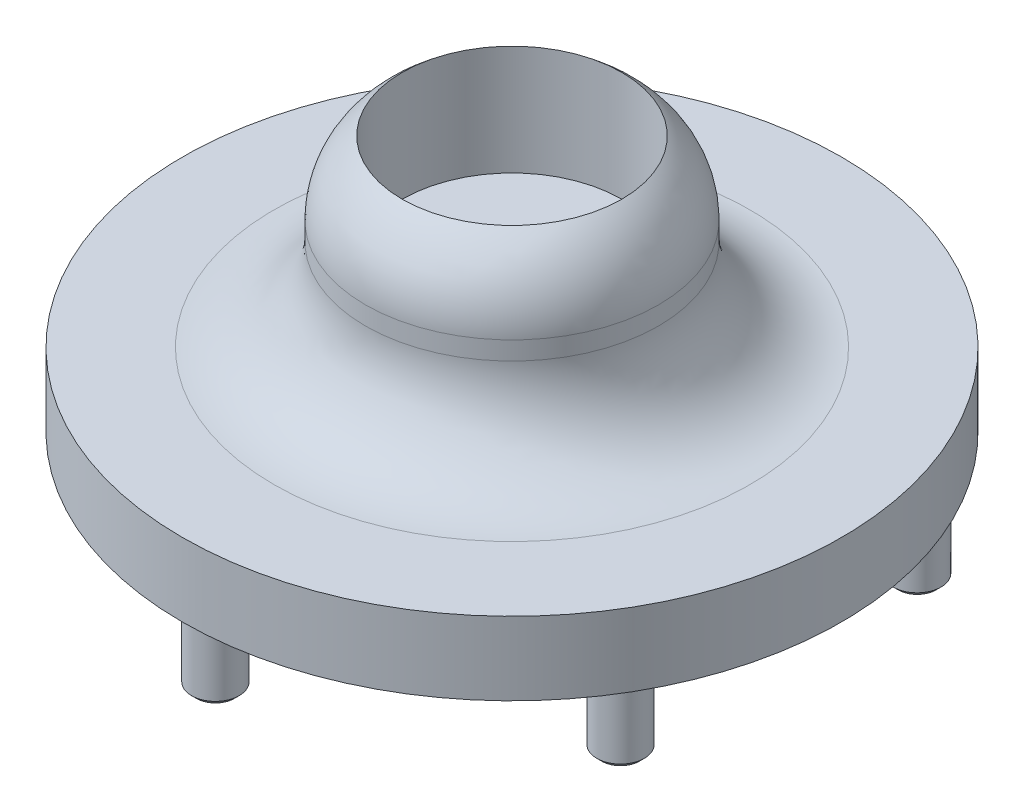
from build123d import *

# Parameters (mm, degrees)
FILLET1_R                    = 37.5
FILLET6_R                    = 37.5
FILLET8_R                    = 22.5
SKETCH4_R                    = 9.749999999999996
BOSS_EXTRUDE2_DEPTH          = 30
CHAMFER1_SIZE                = 2
CIRPATTERN4_COUNT            = 6
CHAMFER1_OF_CIRPATTERN4_SIZE = 2


with BuildPart() as part:
    # Sketch1 → Revolve1 (revolve)
    with BuildSketch(Plane.XY, mode=Mode.PRIVATE) as revolve1_sk:
        Polygon((0, 0), (-45, 0), (-45, 44.99999999999999), (-75.00000000000001, 44.999999999999986), (-75.00000000000001, 59.07407407407406), (-135, 59.074074074074055), (-135, 89.07407407407406), (-60, 89.07407407407405), (-60, 164.07407407407405), (-45.00000000000001, 164.07407407407405), (-45, 119.07407407407403), (0, 119.07407407407403), align=None)
    revolve(revolve1_sk.sketch.rotate(Axis((0, 119.07407407407403, 0), (0, -1, 0)), 270), axis=Axis((0, 119.07407407407403, 0), (0, -1, 0)))

    # Fillet1
    # the kernel refuses this fillet: 37.5 mm, written as the material it adds along each edge
    with BuildSketch(Plane(origin=(0, 89.07407407407405, 0), x_dir=(2.2e-16, 0, 1), z_dir=(1, 0, -2.2e-16))) as fillet1_piece_1:
        with BuildLine():
            CenterArc((60 + FILLET1_R, -FILLET1_R), FILLET1_R, 90, 89.99999999999997)
            Line((60, -FILLET1_R), (60, 0))
            Line((60, 0), (60 + FILLET1_R, -1.421e-14))
        make_face()
    revolve(axis=Axis((0, 89.07407407407405, 0), (0, -1, 0)))
    # the kernel refuses this fillet: 37.5 mm, written as the material it takes off along each edge
    with BuildSketch(Plane(origin=(0, 164.07407407407405, 0), x_dir=(2.2e-16, 0, 1), z_dir=(1, 0, -2.2e-16))) as fillet1_2_piece_1:
        with BuildLine():
            CenterArc((22.5, 30), FILLET1_R, 306.86989764584405, 53.13010235415595)
            Line((45.00000000000001, 0), (60, 0))
            Line((60, 0), (60, 30))
        make_face()
    revolve(axis=Axis((0, 164.07407407407405, 0), (0, -1, 0)), mode=Mode.SUBTRACT)

    # Fillet6
    # the kernel refuses this fillet: 37.5 mm, written as the material it adds along each edge
    with BuildSketch(Plane(origin=(0, 44.999999999999986, 0), x_dir=(2.2e-16, 0, 1), z_dir=(1, 0, -2.2e-16))) as fillet6_piece_1:
        with BuildLine():
            CenterArc((82.5, 36.742346141747674), FILLET6_R, 180, 78.4630409671845)
            Line((45, 36.742346141747674), (44.25, 36.742346141747674))
            Line((44.25, 36.742346141747674), (44.25, 0))
            Line((44.25, 0), (45, -0.75))
            ThreePointArc((45, -0.75), (60.00000000000001, -0.75), (74.85000000000001, -0.7348469228349543))
            Line((74.85000000000001, -0.7348469228349543), (75.00000000000001, 0))
        make_face()
    revolve(axis=Axis((0, 44.999999999999986, 0), (0, -1, 0)))

    # Fillet8
    fillet8_edges = [part.edges().sort_by_distance(p)[0] for p in [
        (-1.55e-14, 0, -45),
    ]]
    fillet(fillet8_edges, radius=FILLET8_R)

    # Sketch4 → Boss-Extrude2 (add)
    with BuildSketch(Plane.XZ.offset(-59.074074074074055)):
        with Locations(Location((0, 121.5, 0), (0, 0, 270))):
            Circle(SKETCH4_R)
    boss_extrude2 = extrude(amount=BOSS_EXTRUDE2_DEPTH)

    # Chamfer1
    chamfer1_edges = [part.edges().sort_by_distance(p)[0] for p in [
        (2.99e-15, 29.074074074074055, 131.25),
    ]]
    chamfer(chamfer1_edges, length=CHAMFER1_SIZE)

    # CirPattern4: Boss-Extrude2 ×6 about axis
    cirpattern4_axis = Axis((1.4387e-13, 0, -3.74e-15), (0, 1, 0))
    for i in range(1, CIRPATTERN4_COUNT):
        add(boss_extrude2.rotate(cirpattern4_axis, i * 360 / CIRPATTERN4_COUNT))

    # Chamfer1 of CirPattern4
    chamfer1_of_cirpattern4_edges = [part.edges().sort_by_distance(p)[0] for p in [
        (113.66583424670763, 29.074074074074055, 65.62500000000014),
        (113.66583424670779, 29.074074074074055, -65.62499999999986),
        (3.0083e-13, 29.074074074074055, -131.25),
        (-113.66583424670732, 29.074074074074055, -65.62500000000018),
        (-113.66583424670749, 29.074074074074055, 65.62499999999989),
    ]]
    chamfer(chamfer1_of_cirpattern4_edges, length=CHAMFER1_OF_CIRPATTERN4_SIZE)


solid = part.part
